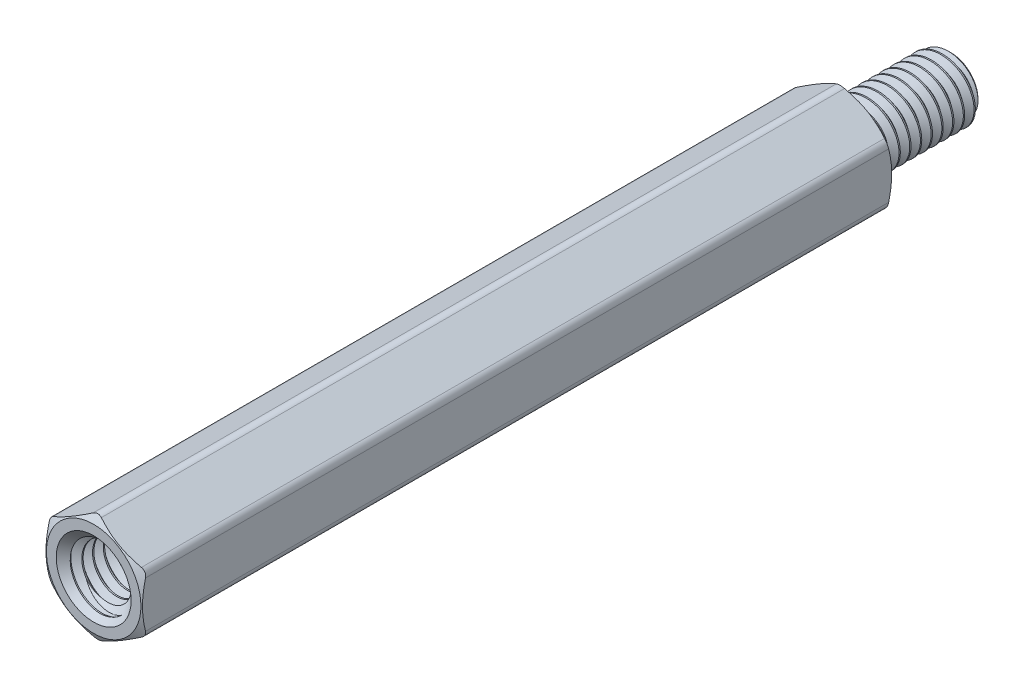
from build123d import *

# Parameters (mm, degrees)
SKETCH4_R           = 1.875
BOSS_EXTRUDE1_DEPTH = 35
SKETCH5_OUTSIDE_W   = 157.156
SKETCH5_OUTSIDE_H   = 157.852
SKETCH5_OUTSIDE_R   = 2.205
CUT_EXTRUDE1_DEPTH  = 41.147384722
CUT_EXTRUDE1_DRAFT  = -60
SKETCH6_OUTSIDE_W   = 139.908
SKETCH6_OUTSIDE_H   = 140.604
SKETCH6_OUTSIDE_R   = 2.205
CUT_EXTRUDE2_DEPTH  = 36.168345142
CUT_EXTRUDE2_DRAFT  = -60
FILLET1_R           = 0.3825
CUT_SWEEP1_PITCH    = 0.5
SKETCH9_R           = 1.75
BOSS_EXTRUDE2_DEPTH = 6.4
SKETCH10_W          = 6.4
SKETCH10_H          = 1.5
CUT_SWEEP2_PITCH    = 0.5
CUT_SWEEP2_TO       = 6.4


with BuildPart() as part:
    # Sketch3 → Revolve1 (revolve)
    with BuildSketch(Plane(origin=(0, 0, 0), x_dir=(0, 0, -1), z_dir=(1, 0, 0))):
        with BuildLine():
            Line((-28.6, 1.25), (-28.6, 0))
            Line((-28.6, 0), (5, 0))
            Line((5, 0), (5, 1.25))
            Line((5, 1.25), (4.75, 1.5))
            Line((4.75, 1.5), (0.7875, 1.5))
            Line((0.7875, 1.5), (0.6, 1.175240474))
            Line((0.6, 1.175240474), (0.25, 1.175240474))
            ThreePointArc((0.25, 1.175240474), (0.073223305, 1.248463778), (0, 1.425240474))
            Line((0, 1.425240474), (0, 2.25))
            Line((0, 2.25), (-35, 2.25))
            Line((-35, 2.25), (-35, 1.75))
            Line((-35, 1.75), (-34.75, 1.5))
            Line((-34.75, 1.5), (-28.85, 1.5))
            Line((-28.85, 1.5), (-28.6, 1.25))
        make_face()
    revolve(axis=Axis((0, 0, -5), (0, 0, 1)))

    # Sketch4 → Boss-Extrude1 (add)
    with BuildSketch(Plane.XY.offset(35)):
        Polygon((-2.25, 1.299038106), (-2.25, -1.299038106), (0, -2.598076211), (2.25, -1.299038106), (2.25, 1.299038106), (0, 2.598076211), align=None)
        Circle(SKETCH4_R, mode=Mode.SUBTRACT)
    extrude(amount=-BOSS_EXTRUDE1_DEPTH)


with BuildPart() as cut_extrude1_tool:
    # Sketch5 outside → Cut-Extrude1 (with draft: the straight prism first)
    with BuildSketch(Plane.XY.offset(35)):
        Rectangle(SKETCH5_OUTSIDE_W, SKETCH5_OUTSIDE_H)
        Circle(SKETCH5_OUTSIDE_R, mode=Mode.SUBTRACT)
    extrude(amount=-CUT_EXTRUDE1_DEPTH)
    # Cut-Extrude1: the draft: its side faces are tilted about the plane it starts from
    cut_extrude1_sides = [cut_extrude1_tool.faces().sort_by_distance(p)[0] for p in [
        (0, -78.926, 14.426307639),
        (78.578, 0, 14.426307639),
        (0, 78.926, 14.426307639),
        (-78.578, 0, 14.426307639),
        (-2.205, 0, 14.426307639),
    ]]
    draft(cut_extrude1_sides, Plane.XY.offset(35), CUT_EXTRUDE1_DRAFT)


with BuildPart() as part_1:
    add(part.part)

    # Cut-Extrude1: cut by cut_extrude1_tool
    add(cut_extrude1_tool.part, mode=Mode.SUBTRACT)


with BuildPart() as cut_extrude2_tool:
    # Sketch6 outside → Cut-Extrude2 (with draft: the straight prism first)
    with BuildSketch(Plane(origin=(0, 0, 0), x_dir=(-1, 0, 0), z_dir=(0, 0, -1))):
        Rectangle(SKETCH6_OUTSIDE_W, SKETCH6_OUTSIDE_H)
        Circle(SKETCH6_OUTSIDE_R, mode=Mode.SUBTRACT)
    extrude(amount=-CUT_EXTRUDE2_DEPTH)
    # Cut-Extrude2: the draft: its side faces are tilted about the plane it starts from
    cut_extrude2_sides = [cut_extrude2_tool.faces().sort_by_distance(p)[0] for p in [
        (0, -70.302, 18.084172571),
        (-69.954, 0, 18.084172571),
        (0, 70.302, 18.084172571),
        (69.954, 0, 18.084172571),
        (2.205, 0, 18.084172571),
    ]]
    draft(cut_extrude2_sides, Plane(origin=(0, 0, 0), x_dir=(-1, 0, 0), z_dir=(0, 0, -1)), CUT_EXTRUDE2_DRAFT)


with BuildPart() as part_2:
    add(part_1.part)

    # Cut-Extrude2: cut by cut_extrude2_tool
    add(cut_extrude2_tool.part, mode=Mode.SUBTRACT)

    # Fillet1
    fillet1_edges = [part_2.edges().sort_by_distance(p)[0] for p in [
        (0, 2.598076211, 17.5),
        (-2.25, -1.299038106, 17.5),
        (0, -2.598076211, 17.5),
        (2.25, -1.299038106, 17.5),
        (2.25, 1.299038106, 17.5),
        (-2.25, 1.299038106, 17.5),
    ]]
    fillet(fillet1_edges, radius=FILLET1_R)

    # Cut-Sweep1: arcs per turn and ends read off the stored shape
    # Cut-Sweep1: the profile of Sketch7 profile screwed along a right-hand helix through 9.7 turns, 6 arcs to a turn; built about Z, then put on its axis
    cut_sweep1_z = Axis((0, 0, 0), (0, 0, 1))
    cut_sweep1_corners = [(1.174940474, 0, -0.187673205), (1.174940474, 0, -0.249826795), (1.527063294, 0, -0.453125), (1.527063294, 0, 0.015625)]
    with BuildLine(mode=Mode.PRIVATE) as cut_sweep1_profile:
        Line(cut_sweep1_corners[0], cut_sweep1_corners[1])
        Line(cut_sweep1_corners[1], cut_sweep1_corners[2])
        Line(cut_sweep1_corners[2], cut_sweep1_corners[3])
        Line(cut_sweep1_corners[3], cut_sweep1_corners[0])
    cut_sweep1_cap = Face(cut_sweep1_profile.wire())
    cut_sweep1_turn_angles = [0, 30, 60, 90, 120, 150, 180, 210, 240, 270, 300, 330, 360]
    cut_sweep1_turn_weights = [1, 0.8660254037844387, 1, 0.8660254037844387, 1, 0.8660254037844387, 1, 0.8660254037844387, 1, 0.8660254037844387, 1, 0.8660254037844387, 1]
    cut_sweep1_turn_rails = [Edge.make_bspline([Vector(p[0], p[1], 0).rotate(cut_sweep1_z, cut_sweep1_turn_angles[k]) / cut_sweep1_turn_weights[k] + Vector(0, 0, p[2] + CUT_SWEEP1_PITCH * cut_sweep1_turn_angles[k] / 360) for k in range(13)], [0, 0, 0, 1, 1, 2, 2, 3, 3, 4, 4, 5, 5, 6, 6, 6], 2, cut_sweep1_turn_weights) for p in cut_sweep1_corners]
    cut_sweep1_turn_sides = [Face.make_surface_from_curves(cut_sweep1_turn_rails[p[0]], cut_sweep1_turn_rails[p[1]]) for p in [(0, 1), (1, 2), (2, 3), (3, 0)]]
    cut_sweep1_last_angles = [3240, 3270, 3300, 3330, 3360, 3390, 3420, 3450, 3480, 3486, 3492]
    cut_sweep1_last_weights = [1, 0.8660254037844387, 1, 0.8660254037844387, 1, 0.8660254037844387, 1, 0.8660254037844387, 1, 0.9945218953682634, 1]
    cut_sweep1_last_rails = [Edge.make_bspline([Vector(p[0], p[1], 0).rotate(cut_sweep1_z, cut_sweep1_last_angles[k]) / cut_sweep1_last_weights[k] + Vector(0, 0, p[2] + CUT_SWEEP1_PITCH * cut_sweep1_last_angles[k] / 360) for k in range(11)], [0, 0, 0, 1, 1, 2, 2, 3, 3, 4, 4, 5, 5, 5], 2, cut_sweep1_last_weights) for p in cut_sweep1_corners]
    cut_sweep1_last_sides = [Face.make_surface_from_curves(cut_sweep1_last_rails[p[0]], cut_sweep1_last_rails[p[1]]) for p in [(0, 1), (1, 2), (2, 3), (3, 0)]]
    cut_sweep1 = Plane(origin=(0, 0, -5), x_dir=(0, 1, 0), z_dir=(0, 0, 1)) * Solid(Shell([*[p.moved(Location((0, 0, CUT_SWEEP1_PITCH * i))) for i in range(9) for p in cut_sweep1_turn_sides], *cut_sweep1_last_sides, cut_sweep1_cap, cut_sweep1_cap.rotate(cut_sweep1_z, 3492).moved(Location((0, 0, CUT_SWEEP1_PITCH * 3492 / 360)))]))
    add(cut_sweep1, mode=Mode.SUBTRACT)

    # Sketch9 → Boss-Extrude2 (add)
    with BuildSketch(Plane.XY.offset(28.6)):
        Circle(SKETCH9_R)
    extrude(amount=BOSS_EXTRUDE2_DEPTH)


with BuildPart() as body_2:
    # Sketch10 → Revolve2 (revolve)
    with BuildSketch(Plane(origin=(0, 0, 0), x_dir=(0, 0, -1), z_dir=(1, 0, 0))):
        with Locations((-31.8, 0.75)):
            Rectangle(SKETCH10_W, SKETCH10_H)
    revolve(axis=Axis((0, 0, -5), (0, 0, 1)))

    # Cut-Sweep2: arcs per turn and ends read off the stored shape
    # Cut-Sweep2: the profile of Sketch12 profile screwed along a right-hand helix through 14.799994 turns, 6 arcs to a turn; built about Z, then put on its axis
    cut_sweep2_z = Axis((0, 0, 0), (0, 0, 1))
    cut_sweep2_corners = [(1.174940474, 0, -0.749826795), (1.174940474, 0, -0.687673205), (1.527063294, 0, -0.484375), (1.527063294, 0, -0.953125)]
    with BuildLine(mode=Mode.PRIVATE) as cut_sweep2_profile:
        Line(cut_sweep2_corners[0], cut_sweep2_corners[1])
        Line(cut_sweep2_corners[1], cut_sweep2_corners[2])
        Line(cut_sweep2_corners[2], cut_sweep2_corners[3])
        Line(cut_sweep2_corners[3], cut_sweep2_corners[0])
    cut_sweep2_cap = Face(cut_sweep2_profile.wire())
    cut_sweep2_turn_angles = [0, 30, 60, 90, 120, 150, 180, 210, 240, 270, 300, 330, 360]
    cut_sweep2_turn_weights = [1, 0.8660254037844387, 1, 0.8660254037844387, 1, 0.8660254037844387, 1, 0.8660254037844387, 1, 0.8660254037844387, 1, 0.8660254037844387, 1]
    cut_sweep2_turn_rails = [Edge.make_bspline([Vector(p[0], p[1], 0).rotate(cut_sweep2_z, cut_sweep2_turn_angles[k]) / cut_sweep2_turn_weights[k] + Vector(0, 0, p[2] + CUT_SWEEP2_PITCH * cut_sweep2_turn_angles[k] / 360) for k in range(13)], [0, 0, 0, 1, 1, 2, 2, 3, 3, 4, 4, 5, 5, 6, 6, 6], 2, cut_sweep2_turn_weights) for p in cut_sweep2_corners]
    cut_sweep2_turn_sides = [Face.make_surface_from_curves(cut_sweep2_turn_rails[p[0]], cut_sweep2_turn_rails[p[1]]) for p in [(0, 1), (1, 2), (2, 3), (3, 0)]]
    cut_sweep2_last_angles = [5040, 5070, 5100, 5130, 5160, 5190, 5220, 5250, 5280, 5303.999, 5327.998]
    cut_sweep2_last_weights = [1, 0.8660254037844387, 1, 0.8660254037844387, 1, 0.8660254037844387, 1, 0.8660254037844387, 1, 0.9135525563970712, 1]
    cut_sweep2_last_rails = [Edge.make_bspline([Vector(p[0], p[1], 0).rotate(cut_sweep2_z, cut_sweep2_last_angles[k]) / cut_sweep2_last_weights[k] + Vector(0, 0, p[2] + CUT_SWEEP2_PITCH * cut_sweep2_last_angles[k] / 360) for k in range(11)], [0, 0, 0, 1, 1, 2, 2, 3, 3, 4, 4, 5, 5, 5], 2, cut_sweep2_last_weights) for p in cut_sweep2_corners]
    cut_sweep2_last_sides = [Face.make_surface_from_curves(cut_sweep2_last_rails[p[0]], cut_sweep2_last_rails[p[1]]) for p in [(0, 1), (1, 2), (2, 3), (3, 0)]]
    cut_sweep2 = Plane(origin=(0, 0, 35), x_dir=(0, 1, 0), z_dir=(0, 0, -1)) * split(Solid(Shell([*[p.moved(Location((0, 0, CUT_SWEEP2_PITCH * i))) for i in range(14) for p in cut_sweep2_turn_sides], *cut_sweep2_last_sides, cut_sweep2_cap, cut_sweep2_cap.rotate(cut_sweep2_z, 5327.998).moved(Location((0, 0, CUT_SWEEP2_PITCH * 5327.998 / 360)))])), bisect_by=Plane.XY.offset(CUT_SWEEP2_TO), keep=Keep.BOTTOM, mode=Mode.PRIVATE)
    add(cut_sweep2, mode=Mode.SUBTRACT)


with BuildPart() as part_3:
    add(part_2.part)

    # Combine1: cut body 2
    add(body_2.part, mode=Mode.SUBTRACT)

    # Cut-Extrude3 cone 1 section (through the dimple's axis) → Cut-Extrude3 (revolve, cut)
    with BuildSketch(Plane(origin=(0, 0, 35), x_dir=(0, -1, 0), z_dir=(1, 0, 0))):
        Polygon((0, 0), (1.7475, 0), (0, 1.7475), align=None)
    revolve(axis=Axis((0, 0, 35), (0, 0, -1)), mode=Mode.SUBTRACT)


solid = part_3.part
